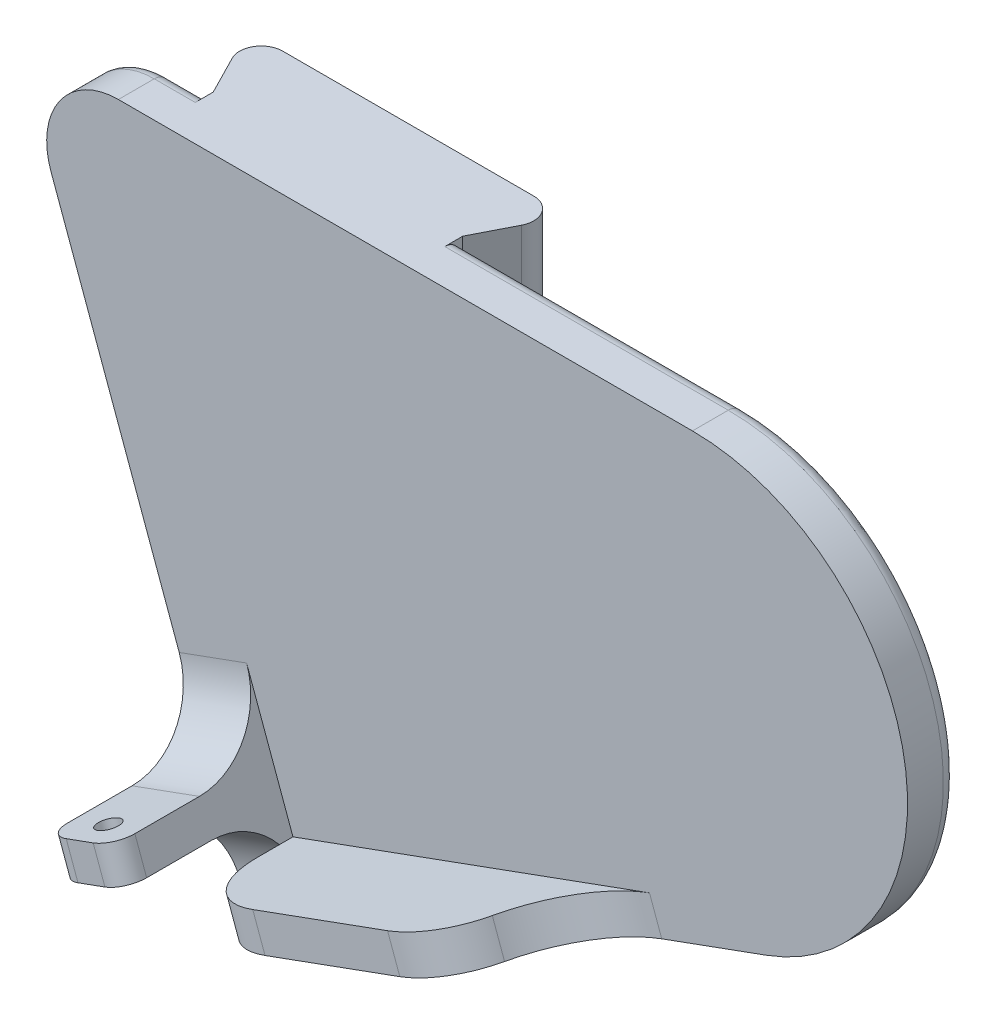
from build123d import *

# Parameters (mm, degrees)
SALIENTE_EXTRUIR1_DEPTH = 18
SALIENTE_EXTRUIR2_DEPTH = 7
CROQUIS4_W              = 22
CROQUIS4_H              = 4.8
SALIENTE_EXTRUIR3_DEPTH = 10
REDONDEO1_R             = 10
REDONDEO2_R             = 3
CROQUIS5_R              = 1.5
CORTAR_EXTRUIR1_DEPTH   = 104.776547512
CROQUIS6_W              = 40
CROQUIS6_H              = 15
SALIENTE_EXTRUIR4_DEPTH = 5
REDONDEO3_R             = 10
REDONDEO4_R             = 15
REDONDEO5_R             = 2


with BuildPart() as part:
    # Croquis1 → Saliente-Extruir1 (new body)
    with BuildSketch(Plane(origin=(0, 0, 0), x_dir=(1, 0, 0), z_dir=(0, 1, 0))):
        with BuildLine():
            Line((-20.173769885, -4.363411025), (-17.4, -9.8))
            Line((-17.4, -9.8), (-17.4, -10.3))
            Line((-17.4, -10.3), (17.4, -10.3))
            Line((17.4, -10.3), (17.4, -9.8))
            Line((17.4, -9.8), (20.173769885, -4.363411025))
            ThreePointArc((20.173769885, -4.363411025), (20.059826813, -1.433193227), (17.501484276, 0))
            Line((17.501484276, 0), (-17.501484276, 0))
            ThreePointArc((-17.501484276, 0), (-20.059826813, -1.433193227), (-20.173769885, -4.363411025))
        make_face()
    extrude(amount=SALIENTE_EXTRUIR1_DEPTH)

    # Croquis2 → Saliente-Extruir2 (add)
    with BuildSketch(Plane.XY.offset(10.3)):
        with BuildLine():
            Line((-17.4, 18), (-23.118519933, 18))
            ThreePointArc((-23.118519933, 18), (-31.310040375, 13.735764364), (-32.51544614, 4.579798567))
            Line((-32.51544614, 4.579798567), (-6.462530087, -67))
            Line((-6.462530087, -67), (67.195200278, -40.190778624))
            ThreePointArc((67.195200278, -40.190778624), (86.478828568, -6.79055467), (56.934595978, 18))
            Line((56.934595978, 18), (-17.4, 18))
        make_face()
    extrude(amount=SALIENTE_EXTRUIR2_DEPTH)

    # Croquis4 → Saliente-Extruir3 (add)
    with BuildSketch(Plane(origin=(-27.239942599, -9.914528289, 0), x_dir=(0, 0, 1), z_dir=(-0.939692620785908, -0.3420201433256697, 0))):
        with Locations((28.3, -49.249090126)):
            Rectangle(CROQUIS4_W, CROQUIS4_H)
    extrude(amount=-SALIENTE_EXTRUIR3_DEPTH)

    # Redondeo1
    # the kernel refuses this fillet: 10 mm, written as the material it adds along each edge
    with BuildSketch(Plane(origin=(-9.574913392, -58.448797151, 17.3), x_dir=(0.3420201433256697, -0.939692620785908, -1.1712242897144546e-15), z_dir=(0.9396926207859081, 0.34202014332566977, 0))) as redondeo1_piece_1:
        with BuildLine():
            CenterArc((10, -9.959417654), REDONDEO1_R, 95.163607091, 84.836392909)
            Line((0, -9.959417654), (-0.2, -9.959417654))
            Line((-0.2, -9.959417654), (-0.2, 0))
            Line((-0.2, 0), (0, 0.2))
            ThreePointArc((0, 0.2), (4.55, 0.2), (9.082, 0.199188353))
            Line((9.082, 0.199188353), (9.1, 0))
        make_face()
    extrude(amount=10)
    with BuildSketch(Plane(origin=(-11.21661008, -53.938272571, 17.3), x_dir=(-0.3420201433256697, 0.939692620785908, 0), z_dir=(0.9396926207859081, 0.34202014332566977, 0))) as redondeo1_piece_2:
        with BuildLine():
            CenterArc((REDONDEO1_R, REDONDEO1_R), REDONDEO1_R, 180, 90)
            Line((0, REDONDEO1_R), (-REDONDEO1_R * 0.02, REDONDEO1_R))
            Line((-REDONDEO1_R * 0.02, REDONDEO1_R), (-REDONDEO1_R * 0.02, -REDONDEO1_R * 0.02))
            Line((-REDONDEO1_R * 0.02, -REDONDEO1_R * 0.02), (REDONDEO1_R, -REDONDEO1_R * 0.02))
            Line((REDONDEO1_R, -REDONDEO1_R * 0.02), (REDONDEO1_R, 0))
        make_face()
    extrude(amount=10)

    # Redondeo2
    redondeo2_edges = [part.edges().sort_by_distance(p)[0] for p in [
        (-0.998835528, -52.773333428, 39.3),
        (-10.395761736, -56.193534861, 39.3),
    ]]
    fillet(redondeo2_edges, radius=REDONDEO2_R)

    # Croquis5 → Cortar-Extruir1 (cut, through all)
    with BuildSketch(Plane(origin=(17.665029208, -48.534268862, 0), x_dir=(0.9396926207859081, 0.34202014332566977, 0), z_dir=(0.3420201433256697, -0.939692620785908, 0))):
        with Locations((-23.988141438, 35.3)):
            Circle(CROQUIS5_R)
    extrude(amount=-CORTAR_EXTRUIR1_DEPTH, mode=Mode.SUBTRACT)

    # Croquis6 → Saliente-Extruir4 (add)
    with BuildSketch(Plane(origin=(20.777412512, -57.085471711, 0), x_dir=(0.9396926207859081, 0.3420201433256697, 0), z_dir=(0.34202014332566966, -0.939692620785908, 0))):
        with Locations((1.011858562, 24.8)):
            Rectangle(CROQUIS6_W, CROQUIS6_H)
    extrude(amount=-SALIENTE_EXTRUIR4_DEPTH)

    # Redondeo3
    redondeo3_edges = [part.edges().sort_by_distance(p)[0] for p in [
        (2.079345762, -61.230567015, 32.3),
        (39.667050594, -47.549761282, 32.3),
    ]]
    fillet(redondeo3_edges, radius=REDONDEO3_R)

    # Redondeo4
    # the kernel refuses this fillet: 15 mm, written as the material it adds along each edge
    with BuildSketch(Plane(origin=(40.522100952, -49.898992834, 17.3), x_dir=(-0.08679417196563514, -0.03159049510327337, 0.9957252695055648), z_dir=(-0.3420201433256697, 0.9396926207859082, 0))) as redondeo4_piece_1:
        with BuildLine():
            CenterArc((13.743188401, 14.243145828), REDONDEO4_R, 185.299645608, 66.421821522)
            Line((-1.192690642, 12.857679399), (-2.686278546, 12.719132757))
            Line((-2.686278546, 12.719132757), (-1.493587904, -0.138546643))
            Line((-1.493587904, -0.138546643), (0.138546643, -1.493587904))
            ThreePointArc((0.138546643, -1.493587904), (5.11717299, -1.031765761), (8.568182674, -1.424314583))
            Line((8.568182674, -1.424314583), (9.03863774, 0))
        make_face()
    extrude(amount=5)

    # Redondeo5
    redondeo5_edges = [part.edges().sort_by_distance(p)[0] for p in [
        (37.167297989, 18, 10.3),
        (-20.259259966, 18, 10.3),
        (-31.310040375, 13.735764364, 10.3),
        (-19.488988114, -31.210100717, 10.3),
        (30.366335095, -53.595389312, 10.3),
        (86.478828568, -6.79055467, 10.3),
    ]]
    fillet(redondeo5_edges, radius=REDONDEO5_R)


solid = part.part
